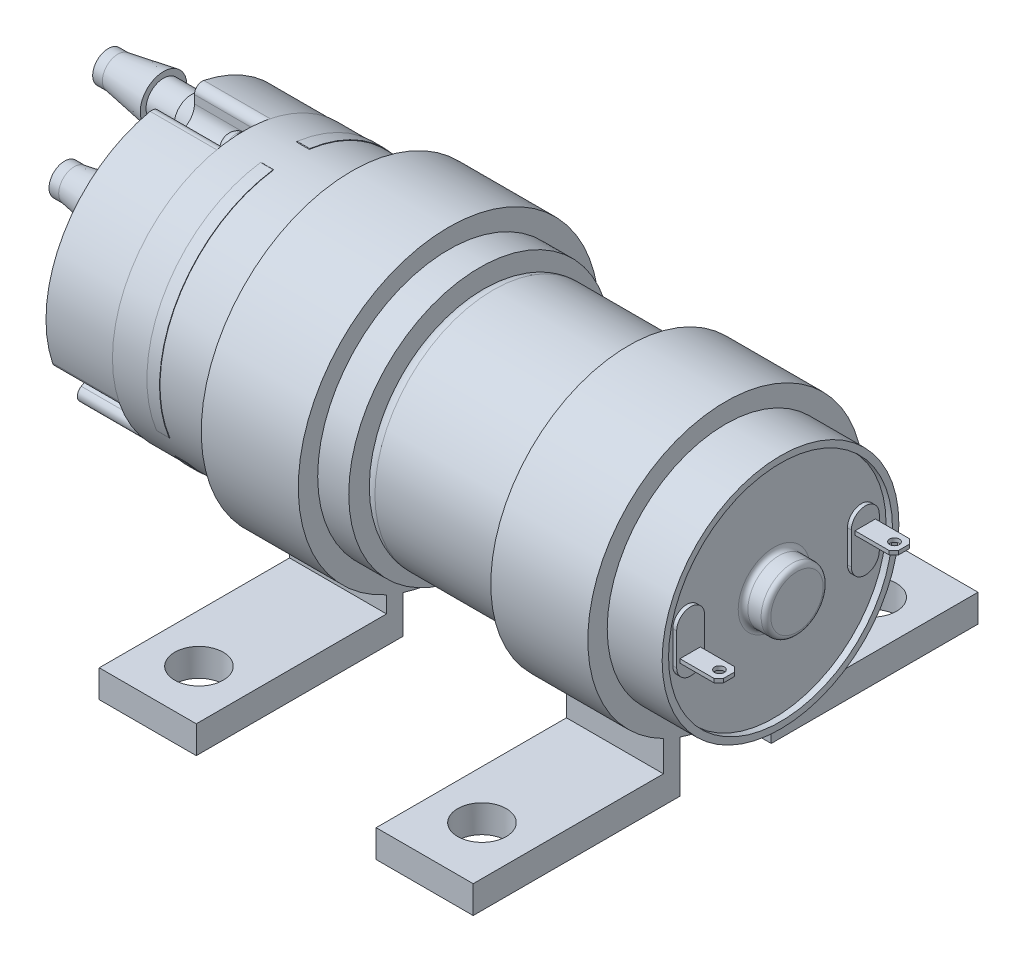
from build123d import *

# Parameters (mm, degrees)
FILLET1_R                 = 0.5
BOSS_EXTRUDE1_DEPTH       = 0.4
SKETCH3_W                 = 2.1
SKETCH3_H                 = 0.4
BOSS_EXTRUDE2_DEPTH       = 4
SKETCH4_R                 = 0.5
CUT_EXTRUDE1_DEPTH        = 4
CHAMFER1_SIZE             = 0.5
FILLET2_R                 = 1.4
SKETCH5_R                 = 13.5
BOSS_EXTRUDE3_DEPTH       = 31.2
BOSS_EXTRUDE4_START       = -12.3
SKETCH6_R                 = 13.55
BOSS_EXTRUDE4_DEPTH       = 12
BOSS_EXTRUDE5_START       = -3.6
BOSS_EXTRUDE5_DEPTH       = 1.3
CUT_EXTRUDE2_DEPTH        = 6.9
FILLET3_R                 = 0.8
CIRPATTERN3_COUNT         = 3
FILLET3_OF_CIRPATTERN3_R  = 0.8
SKETCH9_R                 = 1.3
BOSS_EXTRUDE6_DEPTH       = 1.8
FILLET4_R                 = 1
CUT_EXTRUDE3_DEPTH        = 1
SKETCH11_R                = 1.581796131
BOSS_EXTRUDE7_DEPTH       = 0.4
CIRPATTERN4_START         = -57.1
CIRPATTERN4_OUTLINE_R     = 1.3
CIRPATTERN4_DEPTH         = 1.8
CIRPATTERN4_START_2       = -55.7
CIRPATTERN4_2_OUTLINE_R   = 1.581796131
CIRPATTERN4_2_OUTLINE_R_2 = 1.3
CIRPATTERN4_2_DEPTH       = 0.4
CIRPATTERN4_START_3       = -56.1
CIRPATTERN4_3_DEPTH       = 0.4
LPATTERN1_COUNT           = 2
LPATTERN1_PITCH           = 9
BOSS_EXTRUDE8_START       = -5
SKETCH14_R                = 12.2
BOSS_EXTRUDE8_DEPTH       = 10
BOSS_EXTRUDE9_START       = -28
SKETCH15_R                = 13.5
BOSS_EXTRUDE9_DEPTH       = 10
CUT_EXTRUDE4_DEPTH        = 85.278147836
CUT_EXTRUDE4_DEPTH_BACK   = 85.278147836
SKETCH16_R                = 2.5


with BuildPart() as part:
    # Sketch1 → Revolve1 (revolve)
    with BuildSketch(Plane.XY, mode=Mode.PRIVATE) as revolve1_sk:
        Polygon((-31, 12.2), (0, 12.2), (0, 11.54), (-0.66, 11.54), (-0.66, 3.2), (1.7, 3.2), (1.7, 0), (-31, 0), align=None)
    revolve(revolve1_sk.sketch.rotate(Axis((0, 0, 0), (1, 0, 0)), 90), axis=Axis((0, 0, 0), (1, 0, 0)))

    # Fillet1
    fillet1_edges = [part.edges().sort_by_distance(p)[0] for p in [
        (-0.66, 0, -3.2),
        (1.7, 0, -3.2),
    ]]
    fillet(fillet1_edges, radius=FILLET1_R)

    # Sketch2 → Boss-Extrude1 (add)
    with BuildSketch(Plane(origin=(-0.66, 0, 0), x_dir=(0, 0, -1), z_dir=(1, 0, 0))):
        with BuildLine():
            Line((10.44, 1.65), (10.44, -1.65))
            ThreePointArc((10.44, -1.65), (9, -3.09), (7.56, -1.65))
            Line((7.56, -1.65), (7.56, 1.65))
            ThreePointArc((7.56, 1.65), (9, 3.09), (10.44, 1.65))
        make_face()
        with BuildLine():
            Line((-10.44, 1.65), (-10.44, -1.65))
            ThreePointArc((-10.44, -1.65), (-9, -3.09), (-7.56, -1.65))
            Line((-7.56, -1.65), (-7.56, 1.65))
            ThreePointArc((-7.56, 1.65), (-9, 3.09), (-10.44, 1.65))
        make_face()
    extrude(amount=BOSS_EXTRUDE1_DEPTH)

    # Sketch3 → Boss-Extrude2 (add)
    with BuildSketch(Plane(origin=(-0.26, 0, 0), x_dir=(0, 0, -1), z_dir=(1, 0, 0))):
        with Locations((8.986194495, 1.2)):
            Rectangle(SKETCH3_W, SKETCH3_H)
        with Locations((-9.052027422, -1.2)):
            Rectangle(SKETCH3_W, SKETCH3_H)
    extrude(amount=BOSS_EXTRUDE2_DEPTH)

    # Sketch4 → Cut-Extrude1 (cut)
    with BuildSketch(Plane(origin=(0, 1.4, 0), x_dir=(1, 0, 0), z_dir=(0, 1, 0))):
        with Locations(Location((2.758736959, 8.986194495, 0), (0, 0, 270))):
            Circle(SKETCH4_R)
        with Locations(Location((2.758736959, -9.052027422, 0), (0, 0, 270))):
            Circle(SKETCH4_R)
    extrude(amount=-CUT_EXTRUDE1_DEPTH, mode=Mode.SUBTRACT)

    # Chamfer1
    chamfer1_edges = [part.edges().sort_by_distance(p)[0] for p in [
        (3.74, 1.2, -10.036194495),
        (3.74, 1.2, -7.936194495),
        (3.74, -1.2, 8.002027422),
        (3.74, -1.2, 10.102027422),
    ]]
    chamfer(chamfer1_edges, length=CHAMFER1_SIZE)

    # Fillet2
    fillet2_edges = [part.edges().sort_by_distance(p)[0] for p in [
        (-31, 0, -12.2),
    ]]
    fillet(fillet2_edges, radius=FILLET2_R)

    # Sketch5 → Boss-Extrude3 (add)
    with BuildSketch(Plane.ZY.offset(31)):
        Circle(SKETCH5_R)
    extrude(amount=BOSS_EXTRUDE3_DEPTH)

    # Sketch6 → Boss-Extrude4 (add)
    with BuildSketch(Plane(origin=(-31, 0, 0), x_dir=(0, 0, -1), z_dir=(1, 0, 0)).offset(BOSS_EXTRUDE4_START)):
        Circle(SKETCH6_R)
    extrude(amount=-BOSS_EXTRUDE4_DEPTH)

    # Sketch7 → Boss-Extrude5 (add)
    with BuildSketch(Plane.ZY.offset(55.3).offset(BOSS_EXTRUDE5_START)):
        with BuildLine():
            Line((-1.825, 12.291819434), (1.825, 12.291819434))
            Line((1.825, 12.291819434), (1.825, 13.408145845))
            ThreePointArc((1.825, 13.408145845), (1.845637465, 13.453429295), (1.893353028, 13.467561558))
            ThreePointArc((1.893353028, 13.467561558), (11.777945491, 6.8), (12.60992695, -5.094088958))
            ThreePointArc((12.60992695, -5.094088958), (12.57383027, -5.128345717), (12.524294919, -5.123576561))
            Line((12.524294919, -5.123576561), (11.557527888, -4.565413355))
            Line((11.557527888, -4.565413355), (9.732527888, -7.726406079))
            Line((9.732527888, -7.726406079), (10.699294919, -8.284569284))
            ThreePointArc((10.699294919, -8.284569284), (10.728192805, -8.325083578), (10.716573922, -8.373472599))
            ThreePointArc((10.716573922, -8.373472599), (0, -13.6), (-10.716573922, -8.373472599))
            ThreePointArc((-10.716573922, -8.373472599), (-10.728192805, -8.325083578), (-10.699294919, -8.284569284))
            Line((-10.699294919, -8.284569284), (-9.732527888, -7.726406079))
            Line((-9.732527888, -7.726406079), (-11.557527888, -4.565413355))
            Line((-11.557527888, -4.565413355), (-12.524294919, -5.123576561))
            ThreePointArc((-12.524294919, -5.123576561), (-12.57383027, -5.128345717), (-12.60992695, -5.094088958))
            ThreePointArc((-12.60992695, -5.094088958), (-11.777945491, 6.8), (-1.893353028, 13.467561558))
            ThreePointArc((-1.893353028, 13.467561558), (-1.845637465, 13.453429295), (-1.825, 13.408145845))
            Line((-1.825, 13.408145845), (-1.825, 12.291819434))
        make_face()
    extrude(amount=-BOSS_EXTRUDE5_DEPTH)

    # Sketch8 → Cut-Extrude2 (cut)
    with BuildSketch(Plane.ZY.offset(62.2)):
        with BuildLine():
            Line((-1.8, 11.6), (-1.8, 15.537585437))
            Line((-1.8, 15.537585437), (1.8, 15.537585437))
            Line((1.8, 15.537585437), (1.8, 11.6))
            ThreePointArc((1.8, 11.6), (0, 9.8), (-1.8, 11.6))
        make_face()
    cut_extrude2 = extrude(amount=-CUT_EXTRUDE2_DEPTH, mode=Mode.SUBTRACT)

    # Fillet3
    fillet3_edges = [part.edges().sort_by_distance(p)[0] for p in [
        (-58.75, 13.379461873, -1.8),
        (-58.75, 13.379461873, 1.8),
    ]]
    fillet(fillet3_edges, radius=FILLET3_R)

    # CirPattern3: Cut-Extrude2 ×3 about axis
    cirpattern3_axis = Axis((0, 0, 0), (1, 0, 0))
    for i in range(1, CIRPATTERN3_COUNT):
        add(cut_extrude2.rotate(cirpattern3_axis, i * 360 / CIRPATTERN3_COUNT), mode=Mode.SUBTRACT)

    # Fillet3 of CirPattern3
    fillet3_of_cirpattern3_edges = [part.edges().sort_by_distance(p)[0] for p in [
        (-58.75, -5.130885209, 12.486953871),
        (-58.75, -8.248576663, 10.686953871),
        (-58.75, -8.248576663, -10.686953871),
        (-58.75, -5.130885209, -12.486953871),
    ]]
    fillet(fillet3_of_cirpattern3_edges, radius=FILLET3_OF_CIRPATTERN3_R)

    # Sketch9 → Boss-Extrude6 (add)
    with BuildSketch(Plane.ZY.offset(55.3)):
        with Locations(Location((0, 11.6, 0), (0, 0, 180))):
            Circle(SKETCH9_R)
    extrude(amount=BOSS_EXTRUDE6_DEPTH)

    # Fillet4
    fillet4_edges = [part.edges().sort_by_distance(p)[0] for p in [
        (-57.1, 11.6, 1.3),
    ]]
    fillet(fillet4_edges, radius=FILLET4_R)

    # Sketch10 → Cut-Extrude3 (cut)
    with BuildSketch(Plane.ZY.offset(57.1)):
        Polygon((0.15, 11.75), (0.15, 12.4), (-0.15, 12.4), (-0.15, 11.75), (-0.8, 11.75), (-0.8, 11.45), (-0.15, 11.45), (-0.15, 10.8), (0.15, 10.8), (0.15, 11.45), (0.8, 11.45), (0.8, 11.75), align=None)
    extrude(amount=-CUT_EXTRUDE3_DEPTH, mode=Mode.SUBTRACT)

    # Sketch11 → Boss-Extrude7 (add)
    with BuildSketch(Plane.ZY.offset(55.3)):
        with Locations(Location((0, 11.6, 0), (0, 0, 180))):
            Circle(SKETCH11_R)
    extrude(amount=BOSS_EXTRUDE7_DEPTH)

    # CirPattern4: read off the stored shape, not the designer's step
    # CirPattern4 outline → CirPattern4 (add)
    # profile 1 of 2: a face of its own
    with BuildSketch(Plane.YZ.offset(CIRPATTERN4_START)):
        with Locations((-5.8, 10.045894684)):
            Circle(CIRPATTERN4_OUTLINE_R)
        Polygon((-6.004903811, 10.100798494), (-6.329903811, 10.663715007), (-6.070096189, 10.813715007), (-5.745096189, 10.250798494), (-5.182179677, 10.575798494), (-5.032179677, 10.315990873), (-5.595096189, 9.990990873), (-5.270096189, 9.428074361), (-5.529903811, 9.278074361), (-5.854903811, 9.840990873), (-6.417820323, 9.515990873), (-6.567820323, 9.775798494), align=None, mode=Mode.SUBTRACT)
    # profile 2 of 2: a face of its own
    with BuildSketch(Plane.YZ.offset(CIRPATTERN4_START)):
        with Locations((-5.8, -10.045894684)):
            Circle(CIRPATTERN4_OUTLINE_R)
        Polygon((-5.745096189, -10.250798494), (-6.070096189, -10.813715007), (-6.329903811, -10.663715007), (-6.004903811, -10.100798494), (-6.567820323, -9.775798494), (-6.417820323, -9.515990873), (-5.854903811, -9.840990873), (-5.529903811, -9.278074361), (-5.270096189, -9.428074361), (-5.595096189, -9.990990873), (-5.032179677, -10.315990873), (-5.182179677, -10.575798494), align=None, mode=Mode.SUBTRACT)
    extrude(amount=CIRPATTERN4_DEPTH)

    # CirPattern4 2 outline → CirPattern4 2 (add)
    # profile 1 of 4: a face of its own
    with BuildSketch(Plane.YZ.offset(CIRPATTERN4_START_2)):
        with Locations((-5.8, 10.045894684)):
            Circle(CIRPATTERN4_2_OUTLINE_R)
        with Locations((-5.8, 10.045894684)):
            Circle(CIRPATTERN4_2_OUTLINE_R_2, mode=Mode.SUBTRACT)
    # profile 2 of 4: a face of its own
    with BuildSketch(Plane.YZ.offset(CIRPATTERN4_START_2)):
        Polygon((-6.070096189, 10.813715007), (-6.329903811, 10.663715007), (-6.004903811, 10.100798494), (-6.567820323, 9.775798494), (-6.417820323, 9.515990873), (-5.854903811, 9.840990873), (-5.529903811, 9.278074361), (-5.270096189, 9.428074361), (-5.595096189, 9.990990873), (-5.032179677, 10.315990873), (-5.182179677, 10.575798494), (-5.745096189, 10.250798494), align=None)
    # profile 3 of 4: a face of its own
    with BuildSketch(Plane.YZ.offset(CIRPATTERN4_START_2)):
        with Locations((-5.8, -10.045894684)):
            Circle(CIRPATTERN4_2_OUTLINE_R)
        with Locations((-5.8, -10.045894684)):
            Circle(CIRPATTERN4_2_OUTLINE_R_2, mode=Mode.SUBTRACT)
    # profile 4 of 4: a face of its own
    with BuildSketch(Plane.YZ.offset(CIRPATTERN4_START_2)):
        Polygon((-6.329903811, -10.663715007), (-6.070096189, -10.813715007), (-5.745096189, -10.250798494), (-5.182179677, -10.575798494), (-5.032179677, -10.315990873), (-5.595096189, -9.990990873), (-5.270096189, -9.428074361), (-5.529903811, -9.278074361), (-5.854903811, -9.840990873), (-6.417820323, -9.515990873), (-6.567820323, -9.775798494), (-6.004903811, -10.100798494), align=None)
    extrude(amount=CIRPATTERN4_2_DEPTH)

    # CirPattern4 3 outline → CirPattern4 3 (add)
    with BuildSketch(Plane.YZ.offset(CIRPATTERN4_START_3)):
        Polygon((-6.070096189, 10.813715007), (-6.329903811, 10.663715007), (-6.004903811, 10.100798494), (-6.567820323, 9.775798494), (-6.417820323, 9.515990873), (-5.854903811, 9.840990873), (-5.529903811, 9.278074361), (-5.270096189, 9.428074361), (-5.595096189, 9.990990873), (-5.032179677, 10.315990873), (-5.182179677, 10.575798494), (-5.745096189, 10.250798494), align=None)
        Polygon((-6.329903811, -10.663715007), (-6.070096189, -10.813715007), (-5.745096189, -10.250798494), (-5.182179677, -10.575798494), (-5.032179677, -10.315990873), (-5.595096189, -9.990990873), (-5.270096189, -9.428074361), (-5.529903811, -9.278074361), (-5.854903811, -9.840990873), (-6.417820323, -9.515990873), (-6.567820323, -9.775798494), (-6.004903811, -10.100798494), align=None)
    extrude(amount=CIRPATTERN4_3_DEPTH)

    # CirPattern4 4 outline → CirPattern4 4 (revolve, cut)
    with BuildSketch(Plane(origin=(0, -5.8, 10.045894684), x_dir=(0, 1, 0), z_dir=(0, 0, -1))):
        with BuildLine():
            Line((1.3, -57.1), (1.3, -56.1))
            ThreePointArc((1.3, -56.1), (1.007106781, -56.807106781), (0.3, -57.1))
            Line((0.3, -57.1), (1.3, -57.1))
        make_face()
    revolve(axis=Axis((0, -5.8, 10.045894684), (1, 0, 0)), mode=Mode.SUBTRACT)

    # CirPattern4 5 outline → CirPattern4 5 (revolve, cut)
    with BuildSketch(Plane(origin=(0, -5.8, -10.045894684), x_dir=(0, 1, 0), z_dir=(0, 0, -1))):
        with BuildLine():
            Line((1.3, -57.1), (1.3, -56.1))
            ThreePointArc((1.3, -56.1), (1.007106781, -56.807106781), (0.3, -57.1))
            Line((0.3, -57.1), (1.3, -57.1))
        make_face()
    revolve(axis=Axis((0, -5.8, -10.045894684), (1, 0, 0)), mode=Mode.SUBTRACT)

    # Sketch12 → Revolve2 (revolve)
    with BuildSketch(Plane.XY, mode=Mode.PRIVATE) as revolve2_sk:
        Polygon((-73.789716671, 1.6), (-72.789716671, 1.6), (-68.089716671, 2.4), (-68.089716671, 1.8), (-65.2, 1.8), (-62.2, 2.7), (-62.2, 1), (-73.789716671, 1), align=None)
    revolve2 = revolve(revolve2_sk.sketch.rotate(Axis((0, 0, 0), (-1, 0, 0)), 90), axis=Axis((0, 0, 0), (-1, 0, 0)))

    # LPattern1: Revolve2 ×2
    with Locations(*[Vector(0, 0.8660254037844379, -0.5000000000000012) * (i * LPATTERN1_PITCH) for i in range(1, LPATTERN1_COUNT)]):
        add(revolve2)

    # Sketch14 → Boss-Extrude8 (add)
    with BuildSketch(Plane(origin=(-0.66, 0, 0), x_dir=(0, 0, -1), z_dir=(1, 0, 0)).offset(BOSS_EXTRUDE8_START)):
        with BuildLine():
            Line((6.403675795, -12.674104951), (6.403675795, -15.823807489))
            Line((6.403675795, -15.823807489), (26.013515731, -15.823807489))
            Line((26.013515731, -15.823807489), (26.013515731, -18.671215617))
            Line((26.013515731, -18.671215617), (6.403675795, -18.671215617))
            Line((6.403675795, -18.671215617), (4.704285095, -18.671215617))
            Line((4.704285095, -18.671215617), (4.704285095, -13.398123068))
            ThreePointArc((4.704285095, -13.398123068), (0, -14.2), (-4.704285095, -13.398123068))
            Line((-4.704285095, -13.398123068), (-4.704285095, -18.671215617))
            Line((-4.704285095, -18.671215617), (-6.403675795, -18.671215617))
            Line((-6.403675795, -18.671215617), (-26.013515731, -18.671215617))
            Line((-26.013515731, -18.671215617), (-26.013515731, -15.823807489))
            Line((-26.013515731, -15.823807489), (-6.403675795, -15.823807489))
            Line((-6.403675795, -15.823807489), (-6.403675795, -12.674104951))
            ThreePointArc((-6.403675795, -12.674104951), (0, 14.2), (6.403675795, -12.674104951))
        make_face()
        Circle(SKETCH14_R, mode=Mode.SUBTRACT)
    extrude(amount=-BOSS_EXTRUDE8_DEPTH)

    # Sketch15 → Boss-Extrude9 (add)
    with BuildSketch(Plane.ZY.offset(62.2).offset(BOSS_EXTRUDE9_START)):
        with BuildLine():
            Line((-6.403675795, -15.823807489), (-26.013515731, -15.823807489))
            Line((-26.013515731, -15.823807489), (-26.013515731, -18.671215617))
            Line((-26.013515731, -18.671215617), (-4.704285095, -18.671215617))
            Line((-4.704285095, -18.671215617), (-4.704285095, -14.768876117))
            ThreePointArc((-4.704285095, -14.768876117), (0, -15.5), (4.704285095, -14.768876117))
            Line((4.704285095, -14.768876117), (4.704285095, -18.671215617))
            Line((4.704285095, -18.671215617), (26.013515731, -18.671215617))
            Line((26.013515731, -18.671215617), (26.013515731, -15.823807489))
            Line((26.013515731, -15.823807489), (6.403675795, -15.823807489))
            Line((6.403675795, -15.823807489), (6.403675795, -14.115344002))
            ThreePointArc((6.403675795, -14.115344002), (0, 15.5), (-6.403675795, -14.115344002))
            Line((-6.403675795, -14.115344002), (-6.403675795, -15.823807489))
        make_face()
        Circle(SKETCH15_R, mode=Mode.SUBTRACT)
    extrude(amount=BOSS_EXTRUDE9_DEPTH)

    # Sketch16 → Cut-Extrude4 (cut, two sides: drawn at the far end of the back side and taken through both)
    with BuildSketch(Plane(origin=(0, -15.823807489, 0), x_dir=(1, 0, 0), z_dir=(0, 1, 0)).offset(-CUT_EXTRUDE4_DEPTH_BACK)):
        with Locations(Location((-39.2, 20.756757865, 0), (0, 0, 270))):
            Circle(SKETCH16_R)
        with Locations(Location((-39.2, -20.734276751, 0), (0, 0, 270))):
            Circle(SKETCH16_R)
        with Locations(Location((-10.66, -20.106757865, 0), (0, 0, 270))):
            Circle(SKETCH16_R)
        with Locations(Location((-10.66, 20.109895822, 0), (0, 0, 270))):
            Circle(SKETCH16_R)
    extrude(amount=CUT_EXTRUDE4_DEPTH + CUT_EXTRUDE4_DEPTH_BACK, mode=Mode.SUBTRACT)


solid = part.part
